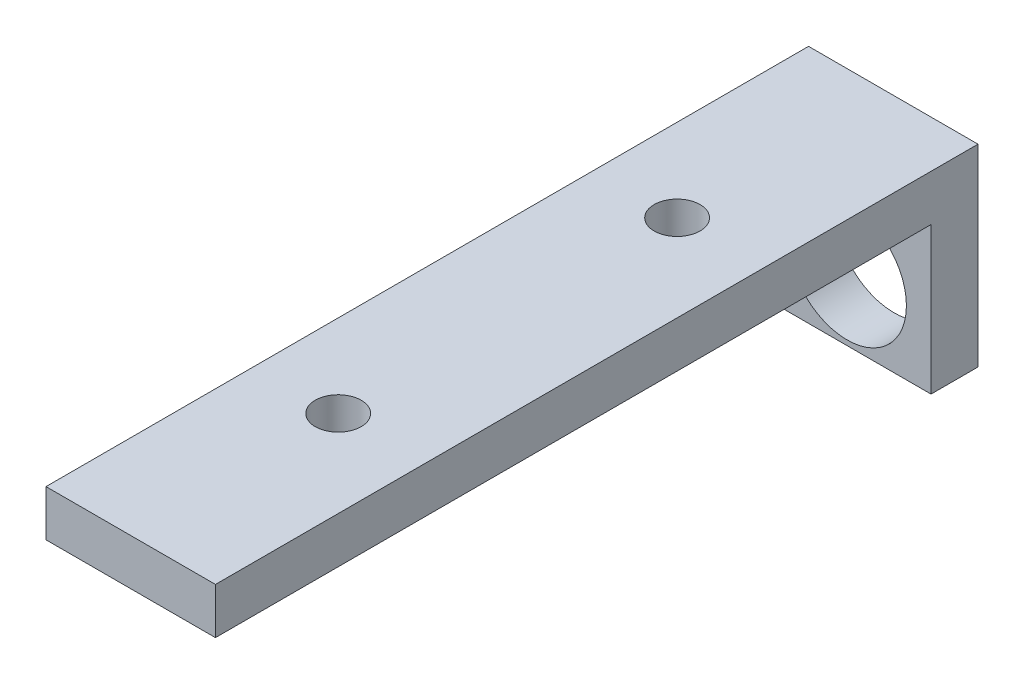
from build123d import *

# Parameters (mm, degrees)
BOSS_EXTRUDE1_DEPTH = 20
SKETCH2_R           = 2.70891122
CUT_EXTRUDE1_DEPTH  = 20
LPATTERN1_COUNT     = 2
LPATTERN1_PITCH     = 40
SKETCH3_R           = 7
CUT_EXTRUDE2_DEPTH  = 20


with BuildPart() as part:
    # Sketch1 → Boss-Extrude1 (new body)
    with BuildSketch(Plane(origin=(0, 0, 0), x_dir=(0, 0, -1), z_dir=(1, 0, 0))):
        Polygon((-49.787234043, 21.769316909), (40.212765957, 21.769316909), (40.212765957, -1.007838746), (34.669652856, -1.007838746), (34.669652856, 16.326987682), (-49.787234043, 16.326987682), align=None)
    extrude(amount=BOSS_EXTRUDE1_DEPTH)

    # Sketch2 → Cut-Extrude1 (cut)
    with BuildSketch(Plane.XZ.offset(-16.326987682)):
        with Locations((9.767198679, 25.067538102)):
            Circle(SKETCH2_R)
    cut_extrude1 = extrude(amount=-CUT_EXTRUDE1_DEPTH, mode=Mode.SUBTRACT)

    # LPattern1: Cut-Extrude1 ×2
    with Locations(*[(0, 0, -i * LPATTERN1_PITCH) for i in range(1, LPATTERN1_COUNT)]):
        add(cut_extrude1, mode=Mode.SUBTRACT)

    # Sketch3 → Cut-Extrude2 (cut)
    with BuildSketch(Plane.XY.offset(-34.669652856)):
        with Locations((10.09426759, 6.577449532)):
            Circle(SKETCH3_R)
    extrude(amount=-CUT_EXTRUDE2_DEPTH, mode=Mode.SUBTRACT)


solid = part.part
